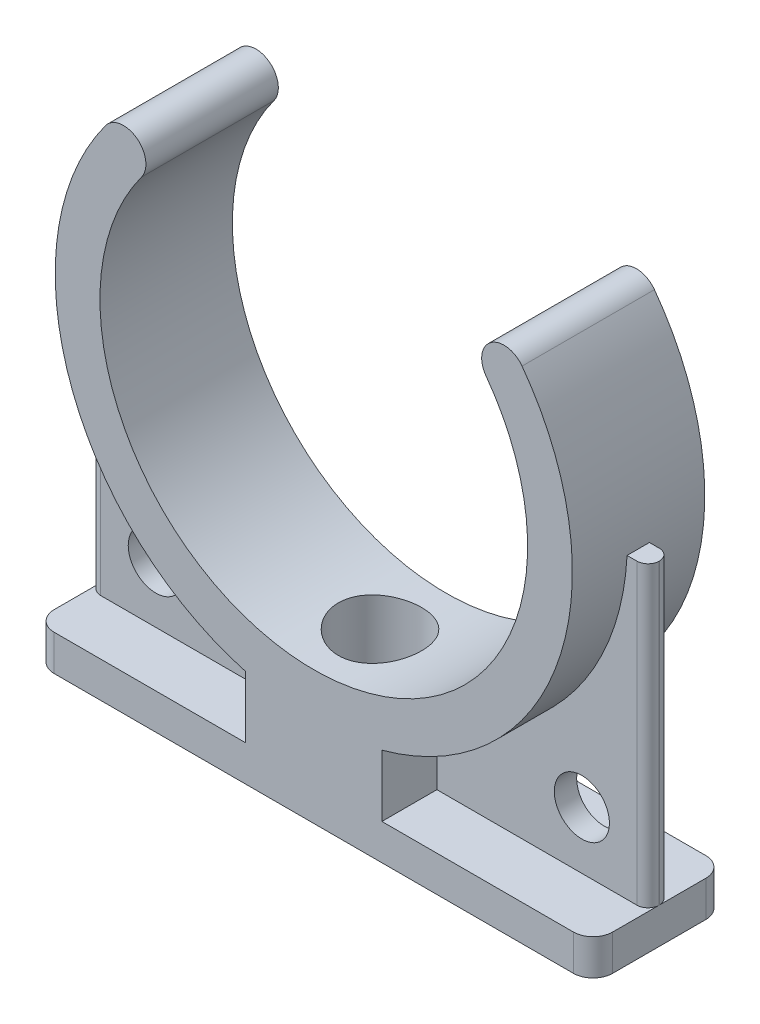
from build123d import *
from build123d.topology import SkipClean

# Parameters (mm, degrees)
BOSS_EXTRUDE1_DEPTH      = 3.175
SKETCH2_W                = 73.3096723
SKETCH2_H                = 3.175
BOSS_EXTRUDE2_DEPTH      = 33.528
BOSS_EXTRUDE3_START      = 7.8105
BOSS_EXTRUDE3_DEPTH      = 7.8105
SKETCH4_W                = 3.175
SKETCH4_H                = 33.528
BOSS_EXTRUDE4_DEPTH      = 2.98186385
SKETCH5_W                = 3.175
SKETCH5_H                = 33.528
BOSS_EXTRUDE5_DEPTH      = 2.98186385
SKETCH6_W                = 79.2734
SKETCH6_H                = 10.9855
BOSS_EXTRUDE6_DEPTH      = 13.843
SKETCH7_W                = 29.972
SKETCH7_H                = 7.8105
CUT_EXTRUDE1_DEPTH       = 8.763
SKETCH8_W                = 29.972
SKETCH8_H                = 7.8105
CUT_EXTRUDE2_DEPTH       = 8.763
BOSS_EXTRUDE7_DEPTH      = 7.8105
CUT_EXTRUDE3_DEPTH       = 97.500739167
SKETCH11_W               = 30.353
SKETCH11_H               = 18.796
HOLE1_D                  = 5.08
HOLE1_CBORE_D            = 11.811
HOLE1_CBORE_DEPTH        = 14.143710789
M7_CLEARANCE_HOLE1_D     = 7.8232
M7_CLEARANCE_HOLE1_DEPTH = 10.9855
M7_CLEARANCE_HOLE2_D     = 7.8232
M7_CLEARANCE_HOLE2_DEPTH = 10.9855
FILLET1_R                = 1.57988
FILLET2_R                = 2.794


with BuildPart() as part:
    # Sketch1 → Boss-Extrude1 (new body)
    with BuildSketch(Plane(origin=(0, 0, -1.5875), x_dir=(-1, 0, 0), z_dir=(0, 0, -1))):
        with BuildLine():
            Line((-36.65483615, 47.371), (36.65483615, 47.371))
            ThreePointArc((36.65483615, 47.371), (0, 85.953679717), (-36.65483615, 47.371))
        make_face()
    extrude(amount=-BOSS_EXTRUDE1_DEPTH)

    # Sketch2 → Boss-Extrude2 (add)
    with BuildSketch(Plane.XZ.offset(-47.371)):
        Rectangle(SKETCH2_W, SKETCH2_H)
    extrude(amount=BOSS_EXTRUDE2_DEPTH)

    # Sketch3 → Boss-Extrude3 (add)
    with SkipClean():  # the faces are left unmerged after this step: merging them gives an invalid solid
        with BuildSketch(Plane(origin=(0, 0, -1.5875), x_dir=(-1, 0, 0), z_dir=(0, 0, -1)).offset(BOSS_EXTRUDE3_START)):
            with BuildLine():
                Line((9.6647, 13.843), (-9.6647, 13.843))
                ThreePointArc((-9.6647, 13.843), (0, 85.953679717), (9.6647, 13.843))
            make_face()
        extrude(amount=-BOSS_EXTRUDE3_DEPTH)

    # Sketch4 → Boss-Extrude4 (add)
    with SkipClean():  # the faces are left unmerged after this step: merging them gives an invalid solid
        with BuildSketch(Plane.ZY.offset(36.65483615)):
            with Locations((0, 30.607)):
                Rectangle(SKETCH4_W, SKETCH4_H)
        extrude(amount=BOSS_EXTRUDE4_DEPTH)

    # Sketch5 → Boss-Extrude5 (add)
    with SkipClean():  # the faces are left unmerged after this step: merging them gives an invalid solid
        with BuildSketch(Plane(origin=(36.65483615, 0, 0), x_dir=(0, 0, -1), z_dir=(1, 0, 0))):
            with Locations((0, 30.607)):
                Rectangle(SKETCH5_W, SKETCH5_H)
        extrude(amount=BOSS_EXTRUDE5_DEPTH)

    # Sketch6 → Boss-Extrude6 (add)
    with SkipClean():  # the faces are left unmerged after this step: merging them gives an invalid solid
        with BuildSketch(Plane.XZ.offset(-13.843)):
            with Locations((0, -3.90525)):
                Rectangle(SKETCH6_W, SKETCH6_H)
        extrude(amount=BOSS_EXTRUDE6_DEPTH)

    # Sketch7 → Cut-Extrude1 (cut)
    with SkipClean():  # the faces are left unmerged after this step: merging them gives an invalid solid
        with BuildSketch(Plane(origin=(0, 13.843, 0), x_dir=(-1, 0, 0), z_dir=(0, 1, 0))):
            with Locations((-24.6507, -5.49275)):
                Rectangle(SKETCH7_W, SKETCH7_H)
        extrude(amount=-CUT_EXTRUDE1_DEPTH, mode=Mode.SUBTRACT)

    # Sketch8 → Cut-Extrude2 (cut)
    with SkipClean():  # the faces are left unmerged after this step: merging them gives an invalid solid
        with BuildSketch(Plane(origin=(0, 13.843, 0), x_dir=(-1, 0, 0), z_dir=(0, 1, 0))):
            with Locations((24.6507, -5.49275)):
                Rectangle(SKETCH8_W, SKETCH8_H)
        extrude(amount=-CUT_EXTRUDE2_DEPTH, mode=Mode.SUBTRACT)

    # Sketch9 → Boss-Extrude7 (add)
    with SkipClean():  # the faces are left unmerged after this step: merging them gives an invalid solid
        with BuildSketch(Plane.XY.offset(1.5875)):
            with BuildLine():
                Line((9.6647, 13.843), (9.6647, 5.08))
                Line((9.6647, 5.08), (39.6367, 5.08))
                Line((39.6367, 5.08), (39.6367, 0))
                Line((39.6367, 0), (-39.6367, 0))
                Line((-39.6367, 0), (-39.6367, 5.08))
                Line((-39.6367, 5.08), (-9.6647, 5.08))
                Line((-9.6647, 5.08), (-9.6647, 13.843))
                ThreePointArc((-9.6647, 13.843), (0, 85.953679717), (9.6647, 13.843))
            make_face()
        extrude(amount=BOSS_EXTRUDE7_DEPTH)

    # Sketch10 → Cut-Extrude3 (cut, through all)
    with SkipClean():  # the faces are left unmerged after this step: merging them gives an invalid solid
        with BuildSketch(Plane.XY.offset(9.398)):
            with BuildLine():
                ThreePointArc((-29.562039749, 71.003748808), (-25.123016493, 71.679265301), (-24.4475, 67.240242044))
                ThreePointArc((-24.4475, 67.240242044), (0, 79.603679717), (24.4475, 67.240242044))
                ThreePointArc((24.4475, 67.240242044), (25.123016493, 71.679265301), (29.562039749, 71.003748808))
                ThreePointArc((29.562039749, 71.003748808), (0, 85.953679717), (-29.562039749, 71.003748808))
            make_face()
        extrude(amount=-CUT_EXTRUDE3_DEPTH, mode=Mode.SUBTRACT)

    # Sketch11 → Cut-Revolve1 (revolve, cut)
    with SkipClean():  # the faces are left unmerged after this step: merging them gives an invalid solid
        with BuildSketch(Plane.XZ.offset(-49.250679717)):
            with Locations((15.1765, 0)):
                Rectangle(SKETCH11_W, SKETCH11_H)
        revolve(axis=Axis((0, 49.250679717, 9.398), (0, 0, -1)), mode=Mode.SUBTRACT)

    # Hole1 (through all)
    with Locations(Plane(origin=(0, 19.477710789, 0), x_dir=(1, 0, 0), z_dir=(0, 1, 0))):
        with Locations((0, 0)):
            CounterBoreHole(HOLE1_D / 2, HOLE1_CBORE_D / 2, HOLE1_CBORE_DEPTH)

    # M7 Clearance Hole1
    with Locations(Plane(origin=(0, 0, -1.5875), x_dir=(-1, 0, 0), z_dir=(0, 0, -1))):
        with Locations((30.2387, 13.208)):
            Hole(M7_CLEARANCE_HOLE1_D / 2, depth=M7_CLEARANCE_HOLE1_DEPTH)

    # M7 Clearance Hole2
    with Locations(Plane.XY.offset(1.5875)):
        with Locations((30.2387, 13.208)):
            Hole(M7_CLEARANCE_HOLE2_D / 2, depth=M7_CLEARANCE_HOLE2_DEPTH)

    # Fillet1
    # the kernel refuses this fillet: 1.57988 mm, written as the material it takes off along each edge
    with BuildSketch(Plane(origin=(-39.6367, 13.843, -1.5875), x_dir=(1, 0, 0), z_dir=(0, 1, 0)), Plane(origin=(39.6367, 51.3207, -1.5875), x_dir=(-1, 0, 0), z_dir=(0, -1, 0)), Plane(origin=(-39.6367, 51.3207, 1.5875), x_dir=(1, 0, 0), z_dir=(0, -1, 0))) as fillet1_piece_1:
        with BuildLine():
            CenterArc((FILLET1_R, -FILLET1_R), FILLET1_R, 90, 90)
            Line((0, -FILLET1_R), (0, 0))
            Line((0, 0), (FILLET1_R, 0))
        make_face()
    extrude(amount=37.4777, mode=Mode.SUBTRACT)
    with BuildSketch(Plane(origin=(39.6367, 13.843, 1.5875), x_dir=(0, 0, -1), z_dir=(0, 1, 0))) as fillet1_piece_2:
        with BuildLine():
            CenterArc((FILLET1_R, FILLET1_R), FILLET1_R, 180, 90)
            Line((0, FILLET1_R), (0, 0))
            Line((0, 0), (FILLET1_R, 0))
        make_face()
    extrude(amount=37.4777, mode=Mode.SUBTRACT)
    with BuildSketch(Plane(origin=(-39.6367, 13.843, 1.5875), x_dir=(1, 0, 0), z_dir=(0, -1, 0)), Plane(origin=(39.6367, 13.843, 1.5875), x_dir=(0, 0, -1), z_dir=(0, -1, 0))) as fillet1_piece_3:
        with BuildLine():
            CenterArc((FILLET1_R, -FILLET1_R), FILLET1_R, 90, 90)
            Line((0, -FILLET1_R), (0, 0))
            Line((0, 0), (FILLET1_R, 0))
        make_face()
    extrude(amount=8.763, mode=Mode.SUBTRACT)
    with BuildSketch(Plane(origin=(39.6367, 13.843, -1.5875), x_dir=(0, 0, 1), z_dir=(0, -1, 0)), Plane(origin=(-39.6367, 13.843, -1.5875), x_dir=(1, 0, 0), z_dir=(0, -1, 0))) as fillet1_piece_4:
        with BuildLine():
            CenterArc((FILLET1_R, FILLET1_R), FILLET1_R, 180, 90)
            Line((0, FILLET1_R), (0, 0))
            Line((0, 0), (FILLET1_R, 0))
        make_face()
    extrude(amount=8.763, mode=Mode.SUBTRACT)

    # Fillet2
    fillet2_edges = [part.edges().sort_by_distance(p)[0] for p in [
        (-39.6367, 2.54, 9.398),
        (39.6367, 2.54, 9.398),
        (-39.6367, 2.54, -9.398),
        (39.6367, 2.54, -9.398),
    ]]
    fillet(fillet2_edges, radius=FILLET2_R)


solid = part.part
